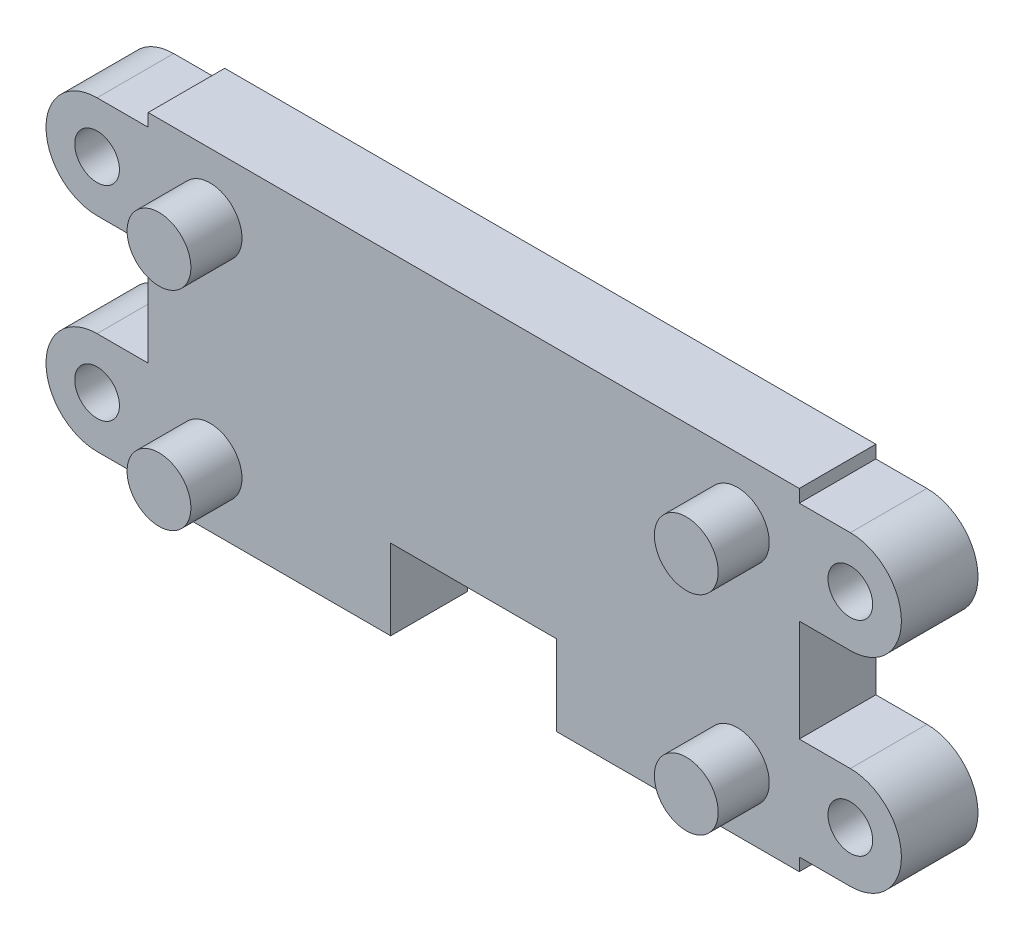
from build123d import *

# Parameters (mm, degrees)
AUFSATZ_LINEAR_AUSTRAGEN1_DEPTH        = 6
F_3_5_3_5_DURCHMESSER_BOHRUNG1_D       = 3.5
F_3_0_3_DURCHMESSER_BOHRUNG2_OUTLINE_R = 1.5
F_3_0_3_DURCHMESSER_BOHRUNG2_DEPTH     = 6
SKIZZE10_R                             = 2.5
AUFSATZ_LINEAR_AUSTRAGEN2_DEPTH        = 4


# Read off the part's stored shape, not the designer's step: Ø3.0 (3) Durchmesser Bohrung2
with BuildPart() as part:
    # Skizze1 → Aufsatz-Linear austragen1 (new body)
    with BuildSketch(Plane.XY):
        with BuildLine():
            Line((-551.752498469, 213.343199998), (-551.752498469, 212.343199998))
            Line((-551.752498469, 212.343199998), (-555.752498469, 212.343199998))
            ThreePointArc((-555.752498469, 212.343199998), (-559.752498469, 208.343199998), (-555.752498469, 204.343199998))
            Line((-555.752498469, 204.343199998), (-551.752498469, 204.343199998))
            Line((-551.752498469, 204.343199998), (-551.752498469, 196.343199998))
            Line((-551.752498469, 196.343199998), (-555.752498469, 196.343199998))
            ThreePointArc((-555.752498469, 196.343199998), (-559.752498469, 192.343199998), (-555.752498469, 188.343199998))
            Line((-555.752498469, 188.343199998), (-551.752498469, 188.343199998))
            Line((-551.752498469, 188.343199998), (-551.752498469, 187.343199998))
            Line((-551.752498469, 187.343199998), (-532.752498469, 187.343199998))
            Line((-532.752498469, 187.343199998), (-532.752498469, 193.634996066))
            Line((-532.752498469, 193.634996066), (-519.752498469, 193.634996066))
            Line((-519.752498469, 193.634996066), (-519.752498469, 187.343199998))
            Line((-519.752498469, 187.343199998), (-500.752498469, 187.343199998))
            Line((-500.752498469, 187.343199998), (-500.752498469, 188.343199998))
            Line((-500.752498469, 188.343199998), (-496.752498469, 188.343199998))
            ThreePointArc((-496.752498469, 188.343199998), (-492.752498469, 192.343199998), (-496.752498469, 196.343199998))
            Line((-496.752498469, 196.343199998), (-500.752498469, 196.343199998))
            Line((-500.752498469, 196.343199998), (-500.752498469, 204.343199998))
            Line((-500.752498469, 204.343199998), (-496.752498469, 204.343199998))
            ThreePointArc((-496.752498469, 204.343199998), (-492.752498469, 208.343199998), (-496.752498469, 212.343199998))
            Line((-496.752498469, 212.343199998), (-500.752498469, 212.343199998))
            Line((-500.752498469, 212.343199998), (-500.752498469, 213.343199998))
            Line((-500.752498469, 213.343199998), (-551.752498469, 213.343199998))
        make_face()
    extrude(amount=AUFSATZ_LINEAR_AUSTRAGEN1_DEPTH)

    # Ø3.5 (3.5) Durchmesser Bohrung1 (through all)
    with Locations(Plane.XY.offset(6)):
        with Locations((-555.752498469, 208.343199998), (-555.752498469, 192.343199998), (-496.752498469, 192.343199998), (-496.752498469, 208.343199998)):
            Hole(F_3_5_3_5_DURCHMESSER_BOHRUNG1_D / 2)

    # Ø3.0 (3) Durchmesser Bohrung2 outline → Ø3.0 (3) Durchmesser Bohrung2 (cut)
    with BuildSketch(Plane.XY):
        with Locations((-546.902498469, 208.493199998)):
            Circle(F_3_0_3_DURCHMESSER_BOHRUNG2_OUTLINE_R)
        with Locations((-505.602498469, 192.193199998)):
            Circle(F_3_0_3_DURCHMESSER_BOHRUNG2_OUTLINE_R)
        with Locations((-546.902498469, 192.193199998)):
            Circle(F_3_0_3_DURCHMESSER_BOHRUNG2_OUTLINE_R)
        with Locations((-505.602498469, 208.493199998)):
            Circle(F_3_0_3_DURCHMESSER_BOHRUNG2_OUTLINE_R)
    extrude(amount=F_3_0_3_DURCHMESSER_BOHRUNG2_DEPTH, mode=Mode.SUBTRACT)

    # Skizze10 → Aufsatz-Linear austragen2 (add)
    with BuildSketch(Plane.XY.offset(6)):
        with Locations((-546.902498469, 208.493199998)):
            Circle(SKIZZE10_R)
        with Locations((-546.902498469, 192.193199998)):
            Circle(SKIZZE10_R)
        with Locations((-505.602498469, 208.493199998)):
            Circle(SKIZZE10_R)
        with Locations((-505.602498469, 192.193199998)):
            Circle(SKIZZE10_R)
    extrude(amount=AUFSATZ_LINEAR_AUSTRAGEN2_DEPTH)


solid = part.part
